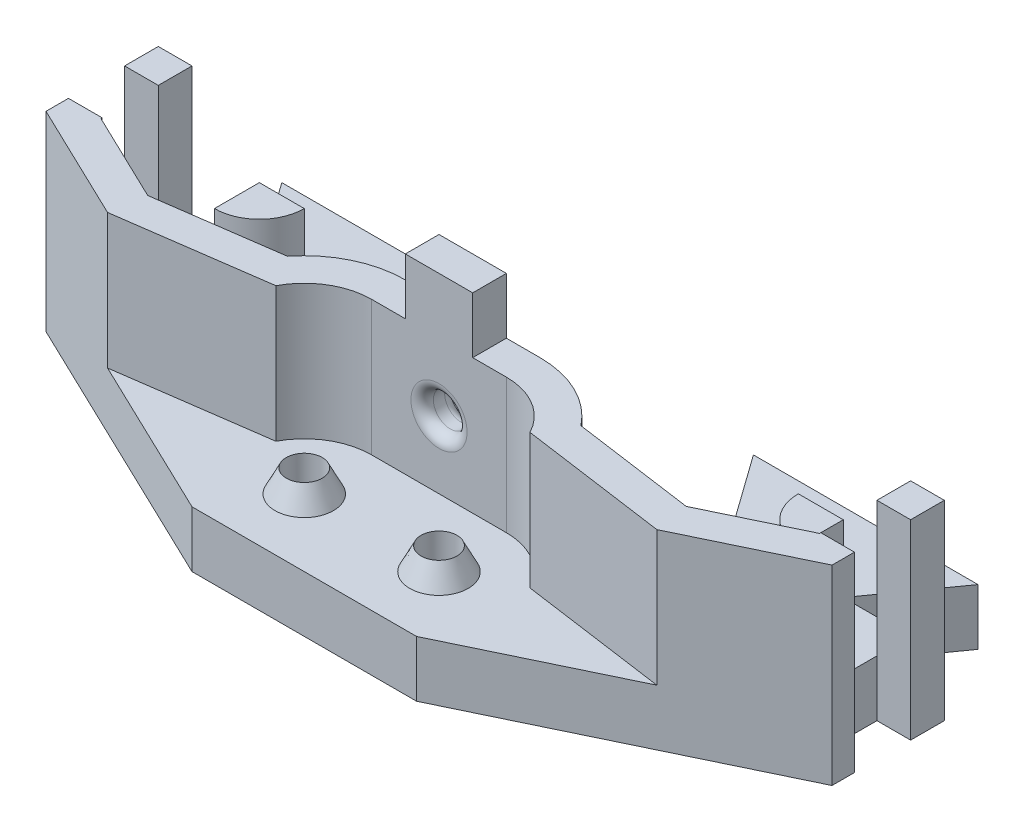
from build123d import *

# Parameters (mm, degrees)
BOSS_EXTRUDE1_DEPTH = 5
SKETCH2_R           = 1.6
CUT_EXTRUDE1_DEPTH  = 3
BOSS_EXTRUDE2_DEPTH = 12
SKETCH8_R           = 1.5
CUT_EXTRUDE2_DEPTH  = 3
FILLET1_R           = 1
SKETCH9_W           = 6
SKETCH9_H           = 3
BOSS_EXTRUDE3_DEPTH = 5
SKETCH12_W          = 3
SKETCH12_H          = 5
CUT_EXTRUDE4_DEPTH  = 17
SKETCH14_W          = 4
SKETCH14_H          = 4
BOSS_EXTRUDE5_DEPTH = 6
FILLET3_R           = 4
FILLET4_R           = 4
BOSS_EXTRUDE6_DEPTH = 5


with BuildPart() as part:
    # Sketch1 → Boss-Extrude1 (new body)
    with BuildSketch(Plane(origin=(0, 0, 0), x_dir=(1, 0, 0), z_dir=(0, 1, 0))):
        Polygon((0, 0), (20, 0), (45, 12), (45, 22), (-25, 22), (-25, 12), align=None)
    extrude(amount=BOSS_EXTRUDE1_DEPTH)

    # Sketch2 → Cut-Extrude1 (cut)
    with BuildSketch(Plane(origin=(0, 5, 0), x_dir=(1, 0, 0), z_dir=(0, 1, 0))):
        with Locations(Location((4, 6, 0), (0, 0, 270))):
            Circle(SKETCH2_R)
        with Locations(Location((16, 6, 0), (0, 0, 90))):
            Circle(SKETCH2_R)
    extrude(amount=-CUT_EXTRUDE1_DEPTH, mode=Mode.SUBTRACT)

    # Sketch3 → Boss-Extrude2 (add)
    with BuildSketch(Plane(origin=(0, 5, 0), x_dir=(1, 0, 0), z_dir=(0, 1, 0))):
        with BuildLine():
            Line((-1.313075459, 8.787692444), (-14.45873126, 6.940191005))
            Line((-14.45873126, 6.940191005), (-25, 12))
            Line((-25, 12), (-25, 22))
            Line((-25, 22), (-22, 22))
            Line((-22, 22), (-22, 13.88770191))
            Line((-22, 13.88770191), (-13.978151779, 10.037214764))
            Line((-13.978151779, 10.037214764), (-3.068994172, 11.57039688))
            ThreePointArc((-3.068994172, 11.57039688), (0.071487045, 14.097332027), (4, 15))
            Line((4, 15), (16, 15))
            ThreePointArc((16, 15), (19.928512955, 14.097332027), (23.068994172, 11.57039688))
            Line((23.068994172, 11.57039688), (33.978151779, 10.037214764))
            Line((33.978151779, 10.037214764), (42, 13.88770191))
            Line((42, 13.88770191), (42, 22))
            Line((42, 22), (45, 22))
            Line((45, 22), (45, 12))
            Line((45, 12), (34.45873126, 6.940191005))
            Line((34.45873126, 6.940191005), (21.313075459, 8.787692444))
            ThreePointArc((21.313075459, 8.787692444), (19.104339329, 11.134498742), (16, 12))
            Line((16, 12), (4, 12))
            ThreePointArc((4, 12), (0.895660671, 11.134498742), (-1.313075459, 8.787692444))
        make_face()
    extrude(amount=BOSS_EXTRUDE2_DEPTH)

    # Sketch6 → Revolve1 (revolve)
    with BuildSketch(Plane.XY.offset(-6), mode=Mode.PRIVATE) as revolve1_sk:
        Polygon((2.4, 5), (2.4, 7), (1.4, 5), align=None)
    revolve(revolve1_sk.sketch.rotate(Axis((4, 5, -6), (0, 1, 0)), 270), axis=Axis((4, 5, -6), (0, 1, 0)))

    # Sketch7 → Revolve2 (revolve)
    with BuildSketch(Plane.XY.offset(-6), mode=Mode.PRIVATE) as revolve2_sk:
        Polygon((14.4, 5), (14.4, 7), (13.4, 5), align=None)
    revolve(revolve2_sk.sketch.rotate(Axis((16, 5, -6), (0, 1, 0)), 270), axis=Axis((16, 5, -6), (0, 1, 0)))

    # Sketch8 → Cut-Extrude2 (cut)
    with BuildSketch(Plane.XY.offset(-12)):
        with Locations((10, 11)):
            Circle(SKETCH8_R)
    extrude(amount=-CUT_EXTRUDE2_DEPTH, mode=Mode.SUBTRACT)

    # Fillet1
    fillet1_edges = [part.edges().sort_by_distance(p)[0] for p in [
        (8.5, 11, -15),
        (8.5, 11, -12),
    ]]
    fillet(fillet1_edges, radius=FILLET1_R)

    # Sketch9 → Boss-Extrude3 (add)
    with BuildSketch(Plane(origin=(0, 17, 0), x_dir=(1, 0, 0), z_dir=(0, 1, 0))):
        with Locations((10, 13.5)):
            Rectangle(SKETCH9_W, SKETCH9_H)
    extrude(amount=BOSS_EXTRUDE3_DEPTH)

    # Sketch12 → Cut-Extrude4 (cut)
    with BuildSketch(Plane(origin=(0, 17, 0), x_dir=(1, 0, 0), z_dir=(0, 1, 0))):
        with Locations((-23.5, 16.5)):
            Rectangle(SKETCH12_W, SKETCH12_H)
        with Locations((43.5, 16.5)):
            Rectangle(SKETCH12_W, SKETCH12_H)
    extrude(amount=-CUT_EXTRUDE4_DEPTH, mode=Mode.SUBTRACT)

    # Sketch14 → Boss-Extrude5 (add)
    with BuildSketch(Plane(origin=(0, 5, 0), x_dir=(1, 0, 0), z_dir=(0, 1, 0))):
        with Locations((34, 20)):
            Rectangle(SKETCH14_W, SKETCH14_H)
        with Locations((-14, 20)):
            Rectangle(SKETCH14_W, SKETCH14_H)
    extrude(amount=BOSS_EXTRUDE5_DEPTH)

    # Fillet3
    fillet3_edges = [part.edges().sort_by_distance(p)[0] for p in [
        (32, 8, -18),
    ]]
    fillet(fillet3_edges, radius=FILLET3_R - 0.0001)  # a hair under: the kernel refuses the full size

    # Fillet4
    fillet4_edges = [part.edges().sort_by_distance(p)[0] for p in [
        (-12, 8, -18),
    ]]
    fillet(fillet4_edges, radius=FILLET4_R - 0.0001)  # a hair under: the kernel refuses the full size

    # Sketch15 → Boss-Extrude6 (add)
    with BuildSketch(Plane(origin=(0, 5, 0), x_dir=(1, 0, 0), z_dir=(0, 1, 0))):
        Polygon((-16, 22), (-21, 29), (-1, 29), (-6, 22), align=None)
        Polygon((36, 22), (26, 22), (21, 29), (41, 29), align=None)
    extrude(amount=-BOSS_EXTRUDE6_DEPTH)


solid = part.part
